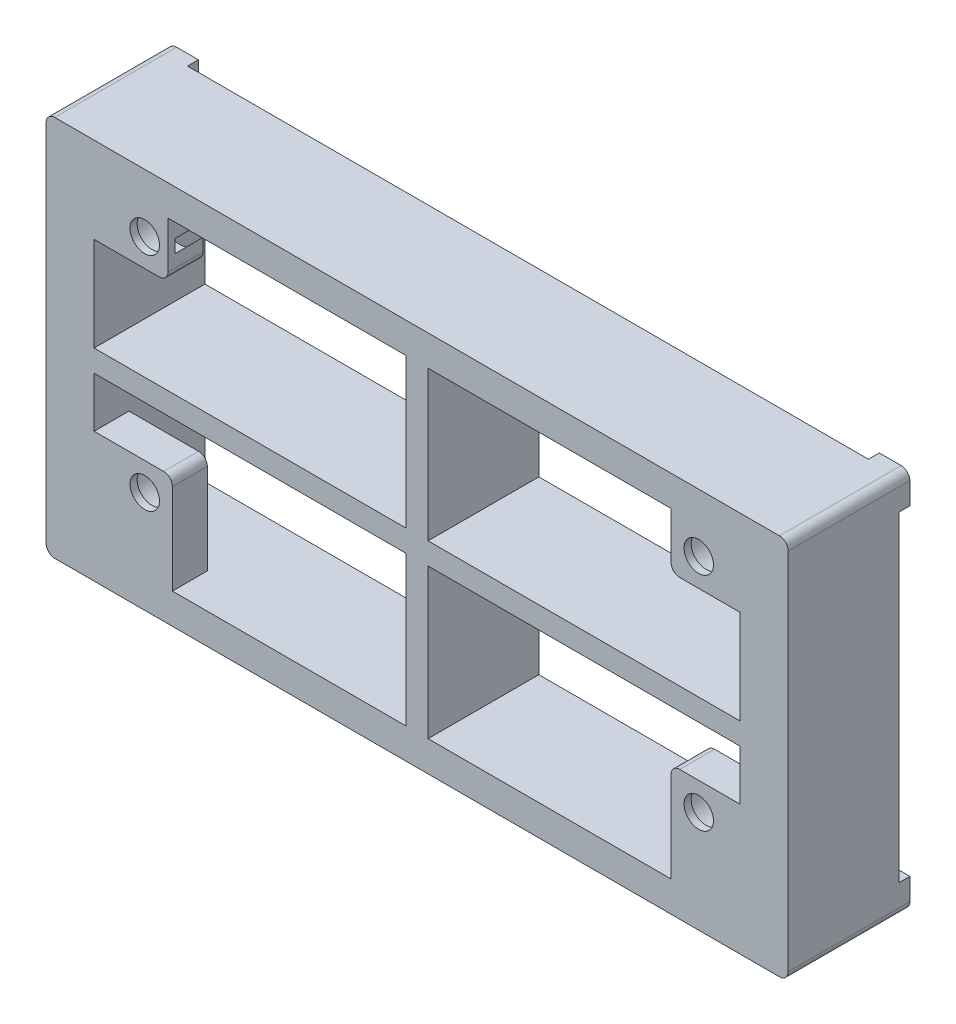
from build123d import *

# Parameters (mm, degrees)
SKETCH1_W                                        = 170.1
SKETCH1_H                                        = 87.55
SKETCH1_W_2                                      = 148.1
SKETCH1_H_2                                      = 73.55
SKETCH1_W_3                                      = 71.55
SKETCH1_H_3                                      = 5
SKETCH1_W_4                                      = 5
SKETCH1_H_4                                      = 34.275
BOSS_EXTRUDE1_DEPTH                              = 25.4
SKETCH2_W                                        = 2.5
SKETCH2_H                                        = 4.5
SKETCH2_W_2                                      = 4.501529918
SKETCH2_H_2                                      = 2.5
SKETCH2_W_3                                      = 4.5
BOSS_EXTRUDE2_DEPTH                              = 2.5
SKETCH3_R                                        = 1.5
BOSS_EXTRUDE3_DEPTH                              = 1
BOSS_EXTRUDE4_DEPTH                              = 8
CBORE_FOR_1_4_SOCKET_HEAD_CAP_SCREW1_D           = 6.7564
CBORE_FOR_1_4_SOCKET_HEAD_CAP_SCREW1_CBORE_D     = 11.1125
CBORE_FOR_1_4_SOCKET_HEAD_CAP_SCREW1_CBORE_DEPTH = 6.35
FILLET1_R                                        = 1
FILLET2_R                                        = 2


with BuildPart() as part:
    # Sketch1 → Boss-Extrude1 (new body)
    # profile 1 of 6: a face of its own
    with BuildSketch(Plane.XY):
        with Locations((-57.284342841, -127.375162174)):
            Rectangle(SKETCH1_W, SKETCH1_H)
        with Locations((-57.284342841, -127.375162174)):
            Rectangle(SKETCH1_W_2, SKETCH1_H_2, mode=Mode.SUBTRACT)
    # profile 2 of 6: a face of its own
    with BuildSketch(Plane.XY):
        with Locations((-95.559342841, -127.375162174)):
            Rectangle(SKETCH1_W_3, SKETCH1_H_3)
    # profile 3 of 6: a face of its own
    with BuildSketch(Plane.XY):
        with Locations((-57.284342841, -107.737662174)):
            Rectangle(SKETCH1_W_4, SKETCH1_H_4)
    # profile 4 of 6: a face of its own
    with BuildSketch(Plane.XY):
        with Locations((-19.009342841, -127.375162174)):
            Rectangle(SKETCH1_W_3, SKETCH1_H_3)
    # profile 5 of 6: a face of its own
    with BuildSketch(Plane.XY):
        with Locations((-57.284342841, -147.012662174)):
            Rectangle(SKETCH1_W_4, SKETCH1_H_4)
    # profile 6 of 6: a face of its own
    with BuildSketch(Plane.XY):
        with Locations((-57.284342841, -127.375162174)):
            Rectangle(SKETCH1_W_4, SKETCH1_H_3)
    extrude(amount=BOSS_EXTRUDE1_DEPTH)

    # Sketch2 → Boss-Extrude2 (add)
    with BuildSketch(Plane(origin=(0, 0, 0), x_dir=(-1, 0, 0), z_dir=(0, 0, -1))):
        Polygon((135.334342841, -168.650162174), (135.334342841, -171.150162174), (142.334342841, -171.150162174), (142.334342841, -168.650162174), (139.834342841, -168.650162174), align=None)
        with Locations((141.084342841, -166.400162174)):
            Rectangle(SKETCH2_W, SKETCH2_H)
        Polygon((139.834342841, -90.600162174), (142.334342841, -90.600162174), (142.334342841, -83.600162174), (139.834342841, -83.600162174), (139.834342841, -86.100162174), align=None)
        with Locations((137.583577882, -84.850162174)):
            Rectangle(SKETCH2_W_2, SKETCH2_H_2)
        Polygon((-27.765657159, -83.600162174), (-27.765657159, -90.600162174), (-25.265657159, -90.600162174), (-25.265657159, -86.100162174), (-25.265657159, -83.600162174), align=None)
        with Locations((-23.015657159, -84.850162174)):
            Rectangle(SKETCH2_W_3, SKETCH2_H_2)
        Polygon((-27.765657159, -164.150162174), (-27.765657159, -171.150162174), (-25.265657159, -171.150162174), (-25.265657159, -168.650162174), (-25.265657159, -164.150162174), align=None)
        with Locations((-23.015657159, -169.900162174)):
            Rectangle(SKETCH2_W_3, SKETCH2_H_2)
    extrude(amount=BOSS_EXTRUDE2_DEPTH)

    # Sketch3 → Boss-Extrude3 (add)
    with BuildSketch(Plane(origin=(0, 0, 0), x_dir=(-1, 0, 0), z_dir=(0, 0, -1))):
        with Locations(Location((-20.265657159, -163.650162174, 0), (0, 0, 180))):
            Circle(SKETCH3_R)
        with Locations(Location((-20.265657159, -91.100162174, 0), (0, 0, 180))):
            Circle(SKETCH3_R)
        with Locations(Location((134.834342841, -163.650162174, 0), (0, 0, 180))):
            Circle(SKETCH3_R)
    extrude(amount=BOSS_EXTRUDE3_DEPTH)

    # Sketch4 → Boss-Extrude4 (add)
    with BuildSketch(Plane.XY.offset(25.4)):
        with BuildLine():
            Line((16.765657159, -90.600162174), (0.915657159, -90.600162174))
            Line((0.915657159, -90.600162174), (0.915657159, -101.300162174))
            ThreePointArc((0.915657159, -101.300162174), (1.501443597, -102.714375736), (2.915657159, -103.300162174))
            Line((2.915657159, -103.300162174), (16.765657159, -103.300162174))
            Line((16.765657159, -103.300162174), (16.765657159, -90.600162174))
        make_face()
        with BuildLine():
            Line((-131.334342841, -164.150162174), (-113.384342841, -164.150162174))
            Line((-113.384342841, -164.150162174), (-113.384342841, -143.400162174))
            ThreePointArc((-113.384342841, -143.400162174), (-113.970129278, -141.985948611), (-115.384342841, -141.400162174))
            Line((-115.384342841, -141.400162174), (-131.334342841, -141.400162174))
            Line((-131.334342841, -141.400162174), (-131.334342841, -164.150162174))
        make_face()
        with BuildLine():
            Line((-131.334342841, -90.600162174), (-114.384342841, -90.600162174))
            Line((-114.384342841, -90.600162174), (-114.384342841, -101.300162174))
            ThreePointArc((-114.384342841, -101.300162174), (-114.970129278, -102.714375736), (-116.384342841, -103.300162174))
            Line((-116.384342841, -103.300162174), (-131.334342841, -103.300162174))
            Line((-131.334342841, -103.300162174), (-131.334342841, -90.600162174))
        make_face()
        with BuildLine():
            Line((16.765657159, -141.400162174), (2.915657159, -141.400162174))
            ThreePointArc((2.915657159, -141.400162174), (1.501443597, -141.985948611), (0.915657159, -143.400162174))
            Line((0.915657159, -143.400162174), (0.915657159, -164.150162174))
            Line((0.915657159, -164.150162174), (16.765657159, -164.150162174))
            Line((16.765657159, -164.150162174), (16.765657159, -141.400162174))
        make_face()
    extrude(amount=-BOSS_EXTRUDE4_DEPTH)

    # CBORE for 1/4 Socket Head Cap Screw1 (through all)
    with Locations(Plane(origin=(0, 0, 17.4), x_dir=(-1, 0, 0), z_dir=(0, 0, -1))):
        with Locations((-7.265657159, -147.750162174), (-7.265657159, -96.950162174), (119.734342841, -96.950162174), (119.734342841, -147.750162174)):
            CounterBoreHole(CBORE_FOR_1_4_SOCKET_HEAD_CAP_SCREW1_D / 2, CBORE_FOR_1_4_SOCKET_HEAD_CAP_SCREW1_CBORE_D / 2, CBORE_FOR_1_4_SOCKET_HEAD_CAP_SCREW1_CBORE_DEPTH)

    # Fillet1
    fillet1_edges = [part.edges().sort_by_distance(p)[0] for p in [
        (18.765657159, -163.650162174, -1),
        (18.765657159, -91.100162174, -1),
        (-136.334342841, -163.650162174, -1),
    ]]
    fillet(fillet1_edges, radius=FILLET1_R - 0.0001)  # a hair under: the kernel refuses the full size

    # Fillet2
    fillet2_edges = [part.edges().sort_by_distance(p)[0] for p in [
        (27.765657159, -83.600162174, 11.45),
        (27.765657159, -171.150162174, 11.45),
        (-142.334342841, -171.150162174, 11.45),
        (-142.334342841, -83.600162174, 11.45),
    ]]
    fillet(fillet2_edges, radius=FILLET2_R)


solid = part.part
